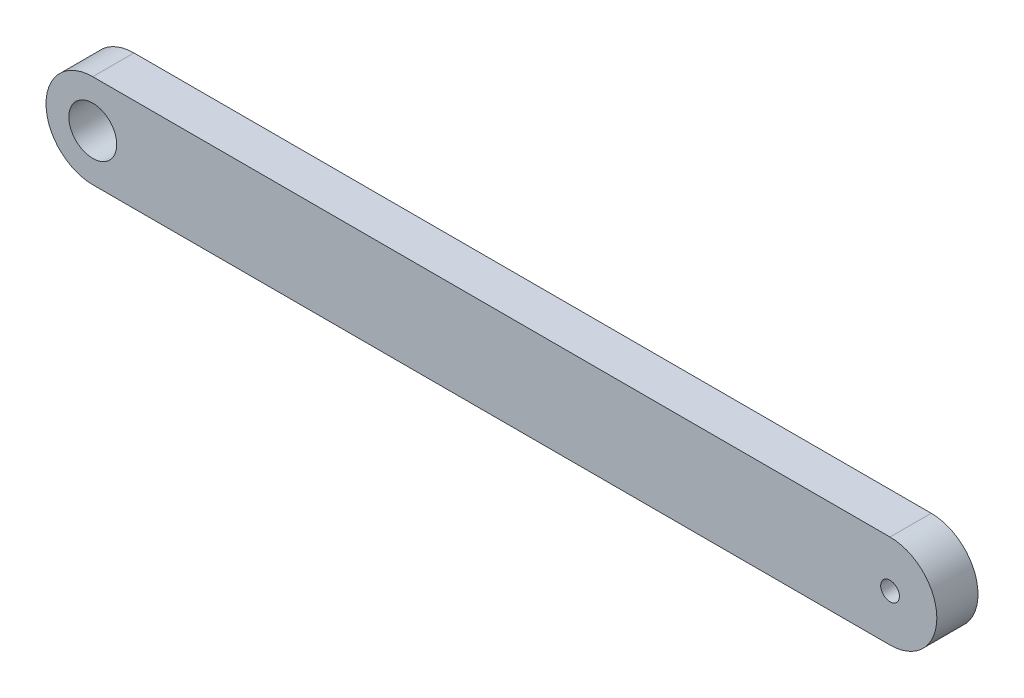
from build123d import *

# Parameters (mm, degrees)
SKETCH1_R           = 1.6
SKETCH1_R_2         = 0.625
BOSS_EXTRUDE1_DEPTH = 2.75


with BuildPart() as part:
    # Sketch1 → Boss-Extrude1 (new body)
    with BuildSketch(Plane.XY):
        with BuildLine():
            Line((0, 3.125), (53.25, 3.125))
            ThreePointArc((53.25, 3.125), (56.375, 0), (53.25, -3.125))
            Line((53.25, -3.125), (0, -3.125))
            ThreePointArc((0, -3.125), (-3.125, 0), (0, 3.125))
        make_face()
        Circle(SKETCH1_R, mode=Mode.SUBTRACT)
        with Locations((53.25, 0)):
            Circle(SKETCH1_R_2, mode=Mode.SUBTRACT)
    extrude(amount=BOSS_EXTRUDE1_DEPTH)


solid = part.part
